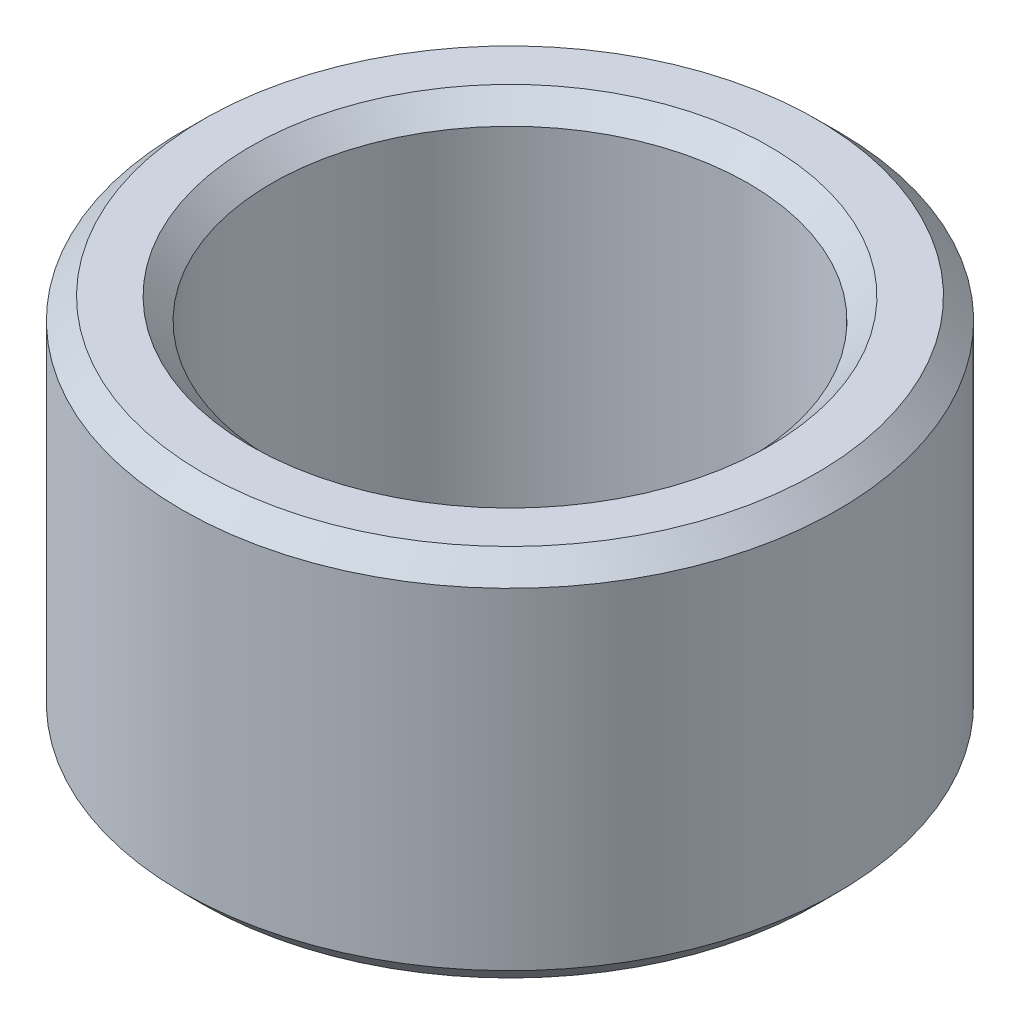
from build123d import *
from OCP.BRepFilletAPI import BRepFilletAPI_MakeChamfer

# Parameters (mm, degrees)
SKETCH1_R           = 25
BOSS_EXTRUDE1_DEPTH = 28.488484565
SKETCH2_R           = 18.170633285
CUT_EXTRUDE1_DEPTH  = 46.404776762
CHAMFER1_SIZE       = 1.615535227
CHAMFER1_SIZE2      = 1.625038508


with BuildPart() as part:
    # Sketch1 → Boss-Extrude1 (new body)
    with BuildSketch(Plane(origin=(0, 0, 0), x_dir=(1, 0, 0), z_dir=(0, 1, 0))):
        Circle(SKETCH1_R)
    extrude(amount=BOSS_EXTRUDE1_DEPTH)

    # Sketch2 → Cut-Extrude1 (cut, through all)
    with BuildSketch(Plane(origin=(0, 0, 0), x_dir=(1, 0, 0), z_dir=(0, 1, 0))):
        Circle(SKETCH2_R)
    extrude(amount=CUT_EXTRUDE1_DEPTH, mode=Mode.SUBTRACT)

    # Chamfer1: one chamfer whose edges measure the first distance from different faces: ONE call of the kernel's chamfer builder (chamfer() names one face for all edges)
    chamfer1_edges_1 = [part.edges().sort_by_distance(p)[0] for p in [
        (-18.170633285, 28.488484565, 0),
    ]]
    chamfer1_side_1 = [part.faces().sort_by_distance(p)[0] for p in [
        (-24.292893219, 28.488484565, 0),
    ]]
    chamfer1_edges_2 = [part.edges().sort_by_distance(p)[0] for p in [
        (-18.170633285, 0, 0),
    ]]
    chamfer1_side_2 = [part.faces().sort_by_distance(p)[0] for p in [
        (-18.170633285, 14.244242282, 0),
    ]]
    chamfer1_edges_3 = [part.edges().sort_by_distance(p)[0] for p in [
        (-25, 0, 0),
    ]]
    chamfer1_side_3 = [part.faces().sort_by_distance(p)[0] for p in [
        (-24.292893219, 0, 0),
    ]]
    chamfer1_edges_4 = [part.edges().sort_by_distance(p)[0] for p in [
        (-25, 28.488484565, 0),
    ]]
    chamfer1_side_4 = [part.faces().sort_by_distance(p)[0] for p in [
        (-25, 14.244242282, 0),
    ]]
    chamfer1 = BRepFilletAPI_MakeChamfer(part.part.solid().wrapped)
    for e in chamfer1_edges_1:
        chamfer1.Add(CHAMFER1_SIZE, CHAMFER1_SIZE2, e.wrapped, chamfer1_side_1[0].wrapped)  # the first distance lies on this face
    for e in chamfer1_edges_2:
        chamfer1.Add(CHAMFER1_SIZE, CHAMFER1_SIZE2, e.wrapped, chamfer1_side_2[0].wrapped)  # the first distance lies on this face
    for e in chamfer1_edges_3:
        chamfer1.Add(CHAMFER1_SIZE, CHAMFER1_SIZE2, e.wrapped, chamfer1_side_3[0].wrapped)  # the first distance lies on this face
    for e in chamfer1_edges_4:
        chamfer1.Add(CHAMFER1_SIZE, CHAMFER1_SIZE2, e.wrapped, chamfer1_side_4[0].wrapped)  # the first distance lies on this face
    add(Compound.cast(chamfer1.Shape()), mode=Mode.REPLACE)


solid = part.part
